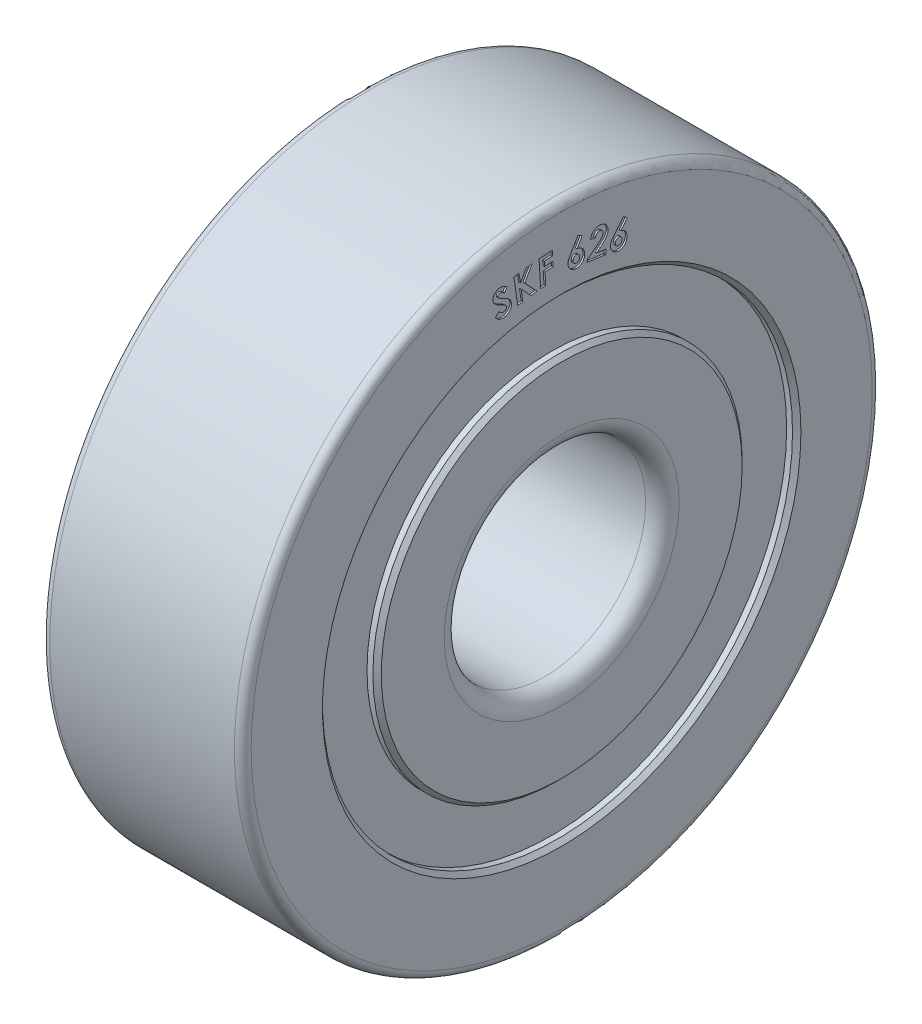
from build123d import *

# Parameters (mm, degrees)
CIRPATTERN2_COUNT = 8
WRAP1_START       = -0.05
WRAP1_DEPTH       = 0.05
SEAL_START        = 0.2
SKETCH7_R         = 7
SKETCH7_R_2       = 5.5
SEAL_1_DEPTH      = 0.2
SKETCH8_R         = 7
SKETCH8_R_2       = 5.5
SEAL_2_DEPTH      = 0.2


# Read off the part's stored shape, not the designer's step: Wrap1
with BuildPart() as part:
    # Sketch1 → Revolve1 (revolve)
    with BuildSketch(Plane.XY, mode=Mode.PRIVATE) as revolve1_sk:
        with BuildLine():
            Line((-5.875, 5.5), (-4.299038106, 5.5))
            ThreePointArc((-4.299038106, 5.5), (-3, 4.75), (-1.700961894, 5.5))
            Line((-1.700961894, 5.5), (-0.125, 5.5))
            Line((-0.125, 5.5), (0, 5.375))
            Line((0, 5.375), (0, 3.5))
            ThreePointArc((0, 3.5), (-0.146446609, 3.146446609), (-0.5, 3))
            Line((-0.5, 3), (-5.5, 3))
            ThreePointArc((-5.5, 3), (-5.853553391, 3.146446609), (-6, 3.5))
            Line((-6, 3.5), (-6, 5.375))
            Line((-6, 5.375), (-5.875, 5.5))
        make_face()
        with BuildLine():
            Line((-0.25, 9.5), (-5.75, 9.5))
            ThreePointArc((-5.75, 9.5), (-5.926776695, 9.426776695), (-6, 9.25))
            Line((-6, 9.25), (-6, 7.125))
            Line((-6, 7.125), (-5.875, 7))
            Line((-5.875, 7), (-4.299038106, 7))
            ThreePointArc((-4.299038106, 7), (-3, 7.75), (-1.700961894, 7))
            Line((-1.700961894, 7), (-0.125, 7))
            Line((-0.125, 7), (0, 7.125))
            Line((0, 7.125), (0, 9.25))
            ThreePointArc((0, 9.25), (-0.073223305, 9.426776695), (-0.25, 9.5))
        make_face()
    revolve(revolve1_sk.sketch.rotate(Axis((0, 0, 0), (-1, 0, 0)), 90), axis=Axis((0, 0, 0), (-1, 0, 0)))

    # Wrap1 outline → Wrap1 (cut)
    # profile 1 of 6: a face of its own
    with BuildSketch(Plane(origin=(0, 0, 0), x_dir=(0, 0, -1), z_dir=(1, 0, 0)).offset(WRAP1_START)):
        with BuildLine():
            add(Edge.make_bspline(
                [(1.759451654, 7.878047553), (1.767456237, 7.876009312), (1.783214619, 7.871996688), (1.805792313, 7.863431175), (1.826888574, 7.852751245), (1.846673566, 7.840301229), (1.864943624, 7.825682011), (1.881849984, 7.809129742), (1.897221692, 7.790428382), (1.911087649, 7.770056312), (1.922971706, 7.748399656), (1.932931888, 7.726066909), (1.940148731, 7.702980972), (1.944913784, 7.679291722), (1.947601462, 7.655037848), (1.947401916, 7.630193955), (1.945363646, 7.604777305), (1.941847034, 7.587902066), (1.940060628, 7.579329604)],
                knots=[0, 0, 0, 0, 0.063628939, 0.12526439, 0.185660671, 0.245628784, 0.305108674, 0.365668937, 0.427665021, 0.491388473, 0.555335004, 0.617834919, 0.679559695, 0.741332517, 0.803852771, 0.867260188, 0.932569432, 1, 1, 1, 1], degree=3))
            Line((1.759451654, 7.878047553), (1.95384268, 8.110579604))
            Line((1.95384268, 8.110579604), (1.842784987, 8.201284733))
            Line((1.842784987, 8.201284733), (1.556246526, 7.857053963))
            add(Edge.make_bspline(
                [(1.454323449, 7.687182169), (1.455772209, 7.693140455), (1.458678673, 7.70509381), (1.464904852, 7.72263858), (1.472435974, 7.739916901), (1.479880225, 7.754256548), (1.486899155, 7.766220449), (1.493448917, 7.77616438), (1.501106835, 7.787211921), (1.5097997, 7.799287093), (1.519867721, 7.812277564), (1.530852422, 7.8264292), (1.543229627, 7.841379188), (1.551811477, 7.851713337), (1.556246526, 7.857053963)],
                knots=[0, 0, 0, 0, 0.091831696, 0.18423027, 0.278509679, 0.3740984, 0.426127344, 0.486294002, 0.552460381, 0.627553072, 0.709202417, 0.798712819, 0.895975981, 1, 1, 1, 1], degree=3))
            add(Edge.make_bspline(
                [(1.644387552, 7.39247063), (1.635893671, 7.394592038), (1.619191541, 7.398763515), (1.595385072, 7.407955603), (1.572996737, 7.41872791), (1.552332504, 7.431841464), (1.533351688, 7.446980404), (1.515926624, 7.464131597), (1.499967987, 7.483215666), (1.486093956, 7.504308961), (1.473981868, 7.526320435), (1.464183077, 7.548874876), (1.456526953, 7.571526766), (1.451429447, 7.594417079), (1.448440481, 7.617435462), (1.448068335, 7.640626687), (1.449674181, 7.664010152), (1.452763594, 7.67940783), (1.454323449, 7.687182169)],
                knots=[0, 0, 0, 0, 0.067356912, 0.132448764, 0.196101472, 0.258410861, 0.32046855, 0.382716808, 0.446392107, 0.511650116, 0.576816012, 0.639633859, 0.700771309, 0.760647539, 0.819934485, 0.87918146, 0.938998315, 1, 1, 1, 1], degree=3))
            add(Edge.make_bspline(
                [(1.940060628, 7.579329604), (1.937974265, 7.571108735), (1.933865552, 7.554919227), (1.925071763, 7.531767052), (1.914572648, 7.509983377), (1.901722668, 7.489802033), (1.887017284, 7.471006069), (1.870131886, 7.453802424), (1.85154375, 7.43779732), (1.830960455, 7.423769274), (1.809350992, 7.411440272), (1.786972103, 7.401437604), (1.764151799, 7.393881122), (1.740958511, 7.388694595), (1.717325721, 7.386010321), (1.693282377, 7.385472296), (1.668782009, 7.387544607), (1.652588368, 7.390814622), (1.644387552, 7.39247063)],
                knots=[0, 0, 0, 0, 0.065304486, 0.128605324, 0.190456379, 0.251320337, 0.312582426, 0.373999182, 0.436769217, 0.501276298, 0.565603226, 0.628248985, 0.689814517, 0.750530771, 0.811030393, 0.872782763, 0.935574386, 1, 1, 1, 1], degree=3))
        make_face()
        with BuildLine():
            add(Edge.make_bspline(
                [(1.599195244, 7.658496271), (1.597870484, 7.651202037), (1.595298768, 7.637041953), (1.596676001, 7.615686092), (1.60156314, 7.595252116), (1.610839778, 7.576433856), (1.622711396, 7.559588059), (1.63749666, 7.546286332), (1.654082947, 7.535963406), (1.666490534, 7.532513275), (1.672752936, 7.530771912)],
                knots=[0, 0, 0, 0, 0.135523526, 0.263087855, 0.389278756, 0.518566272, 0.645572429, 0.764872283, 0.881325486, 1, 1, 1, 1], degree=3))
            add(Edge.make_bspline(
                [(1.719547808, 7.74070781), (1.712893119, 7.741844018), (1.699831173, 7.744074189), (1.680032218, 7.742553316), (1.661148825, 7.736693632), (1.643494686, 7.727122914), (1.627758208, 7.714113149), (1.614701054, 7.698173606), (1.604895781, 7.679372106), (1.601130936, 7.665584933), (1.599195244, 7.658496271)],
                knots=[0, 0, 0, 0, 0.124235, 0.243850773, 0.362356398, 0.486747757, 0.612088683, 0.736803861, 0.864677958, 1, 1, 1, 1], degree=3))
            add(Edge.make_bspline(
                [(1.796470885, 7.613944989), (1.797771987, 7.621183987), (1.800306139, 7.635283354), (1.799241223, 7.656505101), (1.794229616, 7.676630203), (1.785154301, 7.695191181), (1.772966463, 7.711680167), (1.757714863, 7.725156385), (1.739718989, 7.735219676), (1.726382087, 7.738848353), (1.719547808, 7.74070781)],
                knots=[0, 0, 0, 0, 0.132846275, 0.25874418, 0.381457329, 0.50607007, 0.630479865, 0.750427695, 0.872110733, 1, 1, 1, 1], degree=3))
            add(Edge.make_bspline(
                [(1.672752936, 7.530771912), (1.679463014, 7.529629068), (1.692635909, 7.527385494), (1.712653452, 7.529009179), (1.7320076, 7.534592617), (1.750273488, 7.544233496), (1.76675121, 7.557247216), (1.780325898, 7.573482657), (1.790697919, 7.592546522), (1.794511473, 7.6066821), (1.796470885, 7.613944989)],
                knots=[0, 0, 0, 0, 0.122596952, 0.240676296, 0.359208467, 0.484410996, 0.611489601, 0.736188821, 0.864453277, 1, 1, 1, 1], degree=3))
        make_face(mode=Mode.SUBTRACT)
    # profile 2 of 6: a face of its own
    with BuildSketch(Plane(origin=(0, 0, 0), x_dir=(0, 0, -1), z_dir=(1, 0, 0)).offset(WRAP1_START)):
        with BuildLine():
            add(Edge.make_bspline(
                [(0.854276442, 8.092509194), (0.856410428, 8.102752282), (0.860585519, 8.12279263), (0.869458753, 8.151523076), (0.880185403, 8.178300957), (0.892905757, 8.203049681), (0.907296927, 8.225956167), (0.923726648, 8.24675999), (0.942143101, 8.265463122), (0.96229424, 8.282098124), (0.983917072, 8.296474977), (1.006575197, 8.308617402), (1.030349662, 8.318105583), (1.055041161, 8.325183583), (1.080777845, 8.329664541), (1.107438306, 8.331674077), (1.135132326, 8.331474909), (1.15375598, 8.329230417), (1.163250801, 8.328086117)],
                knots=[0, 0, 0, 0, 0.07216084, 0.141180892, 0.207160892, 0.270955112, 0.332920472, 0.393534852, 0.45348102, 0.513698521, 0.57350061, 0.632365095, 0.69074757, 0.749780289, 0.809286327, 0.870657998, 0.934058103, 1, 1, 1, 1], degree=3))
            Line((0.854276442, 8.092509194), (1.000590545, 8.071836117))
            add(Edge.make_bspline(
                [(1.133923878, 8.18914381), (1.129976645, 8.18961132), (1.122205561, 8.190531727), (1.110593807, 8.190283273), (1.099325189, 8.189013692), (1.088377823, 8.186668189), (1.077810382, 8.182870695), (1.06759863, 8.17793185), (1.057765956, 8.171741647), (1.048294822, 8.164591091), (1.039514897, 8.156187081), (1.031339495, 8.146967996), (1.024076566, 8.136739076), (1.017622004, 8.125591302), (1.012034399, 8.113466144), (1.007496321, 8.100372931), (1.003299139, 8.086525914), (1.001510733, 8.076826669), (1.000590545, 8.071836117)],
                knots=[0, 0, 0, 0, 0.060096578, 0.118314671, 0.175278541, 0.231578709, 0.287324642, 0.344819642, 0.402925345, 0.4629185, 0.524114496, 0.586558224, 0.649153559, 0.713636717, 0.781286069, 0.850845839, 0.923255724, 1, 1, 1, 1], degree=3))
            add(Edge.make_bspline(
                [(1.227513621, 8.068951502), (1.228184875, 8.076322381), (1.229484059, 8.090588421), (1.226465974, 8.111687643), (1.219319663, 8.131239885), (1.208132616, 8.148841534), (1.193849295, 8.164234881), (1.176467201, 8.176419564), (1.156158579, 8.184946902), (1.141529107, 8.187708286), (1.133923878, 8.18914381)],
                knots=[0, 0, 0, 0, 0.129857538, 0.25133405, 0.371450626, 0.493482068, 0.615820717, 0.738620533, 0.864120117, 1, 1, 1, 1], degree=3))
            add(Edge.make_bspline(
                [(1.046584134, 7.847316886), (1.054666299, 7.853599802), (1.070276882, 7.865735163), (1.092601144, 7.883621981), (1.11281371, 7.900821537), (1.131115744, 7.917088392), (1.147336531, 7.932674324), (1.161592771, 7.947340901), (1.173879157, 7.961161146), (1.187288383, 7.978091292), (1.20082031, 7.998538191), (1.213673897, 8.022585772), (1.223112528, 8.045798263), (1.226089985, 8.061462048), (1.227513621, 8.068951502)],
                knots=[0, 0, 0, 0, 0.104888376, 0.202590368, 0.293064942, 0.376789794, 0.453435045, 0.523494973, 0.586311268, 0.642813284, 0.744671903, 0.836977179, 0.922052562, 1, 1, 1, 1], degree=3))
            Line((1.046584134, 7.847316886), (0.76773798, 7.63289381))
            Line((0.76773798, 7.63289381), (0.757641827, 7.561098938))
            Line((0.757641827, 7.561098938), (1.303635416, 7.484336117))
            Line((1.303635416, 7.484336117), (1.323186698, 7.623118168))
            Line((1.323186698, 7.623118168), (1.042417468, 7.662701502))
            Line((1.042417468, 7.662701502), (1.144020032, 7.743470733))
            add(Edge.make_bspline(
                [(1.377994391, 8.059816886), (1.376993285, 8.053927932), (1.374969287, 8.04202186), (1.370625647, 8.02410998), (1.364789861, 8.006126897), (1.357933924, 7.987873146), (1.349511428, 7.969628121), (1.33988991, 7.951173022), (1.328941648, 7.932585672), (1.316729101, 7.913664715), (1.302627903, 7.894481912), (1.286517091, 7.874657135), (1.268109168, 7.854341375), (1.247682159, 7.833179786), (1.22487594, 7.811679626), (1.200011016, 7.789355341), (1.172913502, 7.766430993), (1.15383727, 7.751272023), (1.144020032, 7.743470733)],
                knots=[0, 0, 0, 0, 0.044450552, 0.089868489, 0.13701961, 0.185088725, 0.234905083, 0.286475386, 0.339934452, 0.395403326, 0.454010667, 0.517035217, 0.58544749, 0.657987739, 0.735885604, 0.818660122, 0.906676704, 1, 1, 1, 1], degree=3))
            add(Edge.make_bspline(
                [(1.163250801, 8.328086117), (1.174853771, 8.326126723), (1.197529512, 8.322297468), (1.229780593, 8.311880346), (1.259423195, 8.298100652), (1.286119125, 8.280639181), (1.310055872, 8.2602272), (1.330783873, 8.236621133), (1.348017848, 8.209803967), (1.361846049, 8.18067026), (1.37226801, 8.150348079), (1.378583956, 8.119829449), (1.380968155, 8.089545264), (1.378982103, 8.069690937), (1.377994391, 8.059816886)],
                knots=[0, 0, 0, 0, 0.092156886, 0.180102664, 0.264785891, 0.347726877, 0.429403109, 0.510720994, 0.593082626, 0.678503117, 0.763000764, 0.843823192, 0.922329385, 1, 1, 1, 1], degree=3))
        make_face()
    # profile 3 of 6: a face of its own
    with BuildSketch(Plane(origin=(0, 0, 0), x_dir=(0, 0, -1), z_dir=(1, 0, 0)).offset(WRAP1_START)):
        with BuildLine():
            add(Edge.make_bspline(
                [(0.456488424, 8.062377274), (0.464734142, 8.061674883), (0.48101178, 8.060288311), (0.504806963, 8.055593582), (0.527537307, 8.048709657), (0.549168876, 8.039482048), (0.569760664, 8.028077752), (0.589250494, 8.014365298), (0.607538763, 7.998398634), (0.624589511, 7.980530609), (0.640036061, 7.96114985), (0.653477499, 7.940523537), (0.664490113, 7.918838269), (0.673477671, 7.89624373), (0.679797341, 7.872613398), (0.683986169, 7.848047806), (0.685970023, 7.822501537), (0.685442568, 7.805167279), (0.685174321, 7.796351633)],
                knots=[0, 0, 0, 0, 0.063447643, 0.125250183, 0.185658011, 0.245331646, 0.305314037, 0.365910605, 0.427783752, 0.491259179, 0.555130211, 0.617645975, 0.679775074, 0.741414368, 0.803844114, 0.867037159, 0.932379372, 1, 1, 1, 1], degree=3))
            Line((0.456488424, 8.062377274), (0.610494834, 8.325197787))
            Line((0.610494834, 8.325197787), (0.485494834, 8.396832402))
            Line((0.485494834, 8.396832402), (0.258571757, 8.007890095))
            add(Edge.make_bspline(
                [(0.185815347, 7.822633685), (0.186318404, 7.828786169), (0.187329021, 7.841146213), (0.190392298, 7.859588011), (0.194943563, 7.877943942), (0.19987281, 7.893371372), (0.205059749, 7.906271933), (0.209617355, 7.917367501), (0.215474015, 7.929492417), (0.222234792, 7.942833802), (0.229943893, 7.957410919), (0.238568564, 7.973240776), (0.248189822, 7.990227527), (0.255029367, 8.001863502), (0.258571757, 8.007890095)],
                knots=[0, 0, 0, 0, 0.092039995, 0.184903876, 0.278428428, 0.373917537, 0.426143169, 0.485774236, 0.552773827, 0.626885118, 0.708853518, 0.798698404, 0.895740337, 1, 1, 1, 1], degree=3))
            add(Edge.make_bspline(
                [(0.422994834, 7.561896505), (0.414214561, 7.562648615), (0.396974613, 7.564125373), (0.371781508, 7.568984025), (0.347830671, 7.576112176), (0.3252679, 7.585918889), (0.303827414, 7.597590583), (0.283645304, 7.611631807), (0.264860133, 7.628092014), (0.247560071, 7.646574995), (0.23203403, 7.666418897), (0.218452205, 7.687015122), (0.207107845, 7.708214321), (0.198366427, 7.730146305), (0.191491604, 7.752460676), (0.18716143, 7.77540633), (0.185229507, 7.798883821), (0.185618964, 7.814672341), (0.185815347, 7.822633685)],
                knots=[0, 0, 0, 0, 0.06747911, 0.132494315, 0.19619521, 0.258532608, 0.320625011, 0.382954347, 0.446480144, 0.511625321, 0.576631509, 0.639290512, 0.700439698, 0.760479037, 0.819907087, 0.879063942, 0.939018132, 1, 1, 1, 1], degree=3))
            add(Edge.make_bspline(
                [(0.685174321, 7.796351633), (0.684492469, 7.787836088), (0.683153731, 7.771116821), (0.678204139, 7.746699457), (0.671177395, 7.723465204), (0.6620041, 7.701227055), (0.650369862, 7.680251266), (0.636700903, 7.660232712), (0.62072137, 7.641414951), (0.602747249, 7.623985071), (0.583318421, 7.608159366), (0.56281917, 7.594516513), (0.541496041, 7.5832182), (0.519421051, 7.574112234), (0.49638854, 7.567584742), (0.472615553, 7.563293311), (0.448032446, 7.561049113), (0.431437913, 7.561610751), (0.422994834, 7.561896505)],
                knots=[0, 0, 0, 0, 0.065428564, 0.128461246, 0.190502112, 0.251255623, 0.312458612, 0.374011194, 0.436762672, 0.501329821, 0.565657668, 0.628567894, 0.689742116, 0.750339529, 0.811247363, 0.872843505, 0.935304462, 1, 1, 1, 1], degree=3))
        make_face()
        with BuildLine():
            add(Edge.make_bspline(
                [(0.334212783, 7.818146505), (0.334141345, 7.810753395), (0.334001603, 7.796291379), (0.338630879, 7.775285542), (0.347179283, 7.75592824), (0.359268378, 7.738678076), (0.374012683, 7.724160459), (0.390635214, 7.713153664), (0.408833641, 7.705892124), (0.421649601, 7.704451233), (0.428123039, 7.703723428)],
                knots=[0, 0, 0, 0, 0.134746447, 0.263583941, 0.389440509, 0.519132851, 0.646127188, 0.765236844, 0.881419367, 1, 1, 1, 1], degree=3))
            add(Edge.make_bspline(
                [(0.439821757, 7.919588813), (0.433012049, 7.919608225), (0.419691978, 7.919646197), (0.400290749, 7.91480505), (0.382495985, 7.905905528), (0.36656218, 7.893401348), (0.353094919, 7.877932338), (0.342988654, 7.859939402), (0.336398422, 7.839771915), (0.334957428, 7.825514261), (0.334212783, 7.818146505)],
                knots=[0, 0, 0, 0, 0.124690271, 0.243899329, 0.363237497, 0.487657315, 0.613542145, 0.737419285, 0.864309321, 1, 1, 1, 1], degree=3))
            add(Edge.make_bspline(
                [(0.536937142, 7.8067683), (0.536996148, 7.814159052), (0.537111065, 7.828552902), (0.532715045, 7.849412972), (0.524327776, 7.868483707), (0.512295025, 7.885338662), (0.497479836, 7.899675562), (0.480188073, 7.91045737), (0.460717843, 7.917475454), (0.44693121, 7.918869787), (0.439821757, 7.919588813)],
                knots=[0, 0, 0, 0, 0.133049271, 0.259119961, 0.381238965, 0.506377976, 0.630432414, 0.750770185, 0.871477849, 1, 1, 1, 1], degree=3))
            add(Edge.make_bspline(
                [(0.428123039, 7.703723428), (0.434991661, 7.703683225), (0.448440732, 7.703604506), (0.468023272, 7.708773365), (0.486266397, 7.717563899), (0.502830411, 7.730106387), (0.51714134, 7.745597285), (0.527658078, 7.764045264), (0.53486977, 7.784584274), (0.53623451, 7.799228682), (0.536937142, 7.8067683)],
                knots=[0, 0, 0, 0, 0.122998707, 0.240836987, 0.360225965, 0.485051329, 0.6121639, 0.736504533, 0.864340367, 1, 1, 1, 1], degree=3))
        make_face(mode=Mode.SUBTRACT)
    # profile 4 of 6: a face of its own
    with BuildSketch(Plane(origin=(0, 0, 0), x_dir=(0, 0, -1), z_dir=(1, 0, 0)).offset(WRAP1_START)):
        with BuildLine():
            add(Edge.make_bspline(
                [(-1.709010615, 8.002365382), (-1.715129781, 8.007590236), (-1.726932219, 8.017667754), (-1.745171218, 8.030625686), (-1.762900161, 8.04115707), (-1.780036912, 8.0493871), (-1.796842928, 8.054678447), (-1.813089585, 8.057731413), (-1.828925396, 8.058174766), (-1.83910127, 8.056429168), (-1.844106769, 8.055570511)],
                knots=[0, 0, 0, 0, 0.160195847, 0.308980266, 0.444915779, 0.570570229, 0.686653874, 0.794755029, 0.899040267, 1, 1, 1, 1], degree=3))
            Line((-1.709010615, 8.002365382), (-1.622311897, 8.123358972))
            add(Edge.make_bspline(
                [(-1.874234974, 8.196916665), (-1.864600577, 8.198839165), (-1.845460783, 8.202658425), (-1.816190401, 8.203652305), (-1.786917047, 8.201711753), (-1.76257071, 8.196746997), (-1.742741046, 8.191086399), (-1.727252644, 8.185246158), (-1.711172053, 8.178141061), (-1.694501419, 8.169770666), (-1.677221156, 8.160165452), (-1.659362438, 8.14920703), (-1.640962385, 8.136849284), (-1.628641867, 8.12793758), (-1.622311897, 8.123358972)],
                knots=[0, 0, 0, 0, 0.10827595, 0.215102132, 0.322099035, 0.431489829, 0.488589086, 0.549594541, 0.614012172, 0.682571047, 0.755417687, 0.832170822, 0.913773626, 1, 1, 1, 1], degree=3))
            add(Edge.make_bspline(
                [(-2.041863179, 7.952846152), (-2.04316336, 7.959503855), (-2.045727711, 7.972634859), (-2.047368589, 7.992456605), (-2.046711045, 8.011968431), (-2.043912155, 8.031178432), (-2.039286483, 8.050155276), (-2.032530184, 8.068886486), (-2.023413965, 8.087144835), (-2.012588236, 8.105037951), (-2.00005245, 8.122000469), (-1.986120958, 8.137702744), (-1.970553374, 8.151494543), (-1.953894675, 8.163859905), (-1.935954515, 8.174723166), (-1.916609602, 8.183844466), (-1.895952033, 8.191411713), (-1.881536991, 8.195065712), (-1.874234974, 8.196916665)],
                knots=[0, 0, 0, 0, 0.061706444, 0.121703774, 0.180563573, 0.239006258, 0.298082513, 0.358062111, 0.419812591, 0.483515034, 0.548178674, 0.611527635, 0.674190059, 0.737102829, 0.800137586, 0.864726248, 0.931476346, 1, 1, 1, 1], degree=3))
            add(Edge.make_bspline(
                [(-1.780164461, 7.727685895), (-1.792156403, 7.733671184), (-1.815181279, 7.745163111), (-1.84791089, 7.762518937), (-1.877594362, 7.778979461), (-1.904144367, 7.794649176), (-1.927642831, 7.809320442), (-1.947895803, 7.823292338), (-1.965136959, 7.836308217), (-1.983459467, 7.852520138), (-2.002219385, 7.872839001), (-2.020200564, 7.89837137), (-2.034086158, 7.924859241), (-2.039292263, 7.943594283), (-2.041863179, 7.952846152)],
                knots=[0, 0, 0, 0, 0.112719796, 0.216425271, 0.311556546, 0.39816443, 0.475696597, 0.544489667, 0.605056225, 0.657254276, 0.750098278, 0.836851707, 0.919432973, 1, 1, 1, 1], degree=3))
            add(Edge.make_bspline(
                [(-1.644587538, 7.618711536), (-1.645824373, 7.623042433), (-1.648343864, 7.631864673), (-1.655141118, 7.644354731), (-1.664492246, 7.656103974), (-1.67413819, 7.665447711), (-1.68356716, 7.672953611), (-1.692488637, 7.679203036), (-1.703014208, 7.686050988), (-1.715218675, 7.693393394), (-1.729036334, 7.701288951), (-1.744613179, 7.709522764), (-1.761741968, 7.718586113), (-1.773845457, 7.724564626), (-1.780164461, 7.727685895)],
                knots=[0, 0, 0, 0, 0.075187645, 0.153160762, 0.235944607, 0.325701743, 0.377211205, 0.437476499, 0.507884735, 0.587289417, 0.675760048, 0.774133617, 0.882079426, 1, 1, 1, 1], degree=3))
            add(Edge.make_bspline(
                [(-1.717183692, 7.525121793), (-1.711131387, 7.526794238), (-1.699427753, 7.530028327), (-1.68335062, 7.53804319), (-1.669571263, 7.54857817), (-1.658244698, 7.561241278), (-1.649572457, 7.575101502), (-1.644310802, 7.589627569), (-1.642262849, 7.60436399), (-1.643810133, 7.613913538), (-1.644587538, 7.618711536)],
                knots=[0, 0, 0, 0, 0.143416428, 0.277331291, 0.408114034, 0.537933778, 0.664124174, 0.779718861, 0.889323701, 1, 1, 1, 1], degree=3))
            add(Edge.make_bspline(
                [(-1.868786256, 7.598198716), (-1.86234237, 7.591127276), (-1.85005872, 7.577647353), (-1.830410753, 7.560254852), (-1.811319993, 7.54572552), (-1.792033216, 7.534905428), (-1.773075348, 7.527064836), (-1.754141002, 7.523136871), (-1.735398942, 7.521775093), (-1.723254755, 7.524006352), (-1.717183692, 7.525121793)],
                knots=[0, 0, 0, 0, 0.162243303, 0.309276108, 0.444717657, 0.568521608, 0.683668616, 0.791243736, 0.895639584, 1, 1, 1, 1], degree=3))
            Line((-1.868786256, 7.598198716), (-1.975356769, 7.4953141))
            add(Edge.make_bspline(
                [(-1.688177281, 7.384576921), (-1.694997791, 7.383141129), (-1.708408771, 7.380317972), (-1.7285595, 7.377860728), (-1.748305313, 7.376414904), (-1.76769707, 7.376854413), (-1.786719015, 7.378380264), (-1.805364592, 7.381456798), (-1.823646964, 7.385922072), (-1.841531256, 7.391912103), (-1.859124527, 7.399318507), (-1.876462376, 7.408358225), (-1.893632578, 7.418920946), (-1.910438777, 7.431225817), (-1.92717733, 7.444811913), (-1.943515303, 7.460162618), (-1.959758367, 7.476982582), (-1.970079901, 7.489112632), (-1.975356769, 7.4953141)],
                knots=[0, 0, 0, 0, 0.06398805, 0.125817931, 0.18629368, 0.245668755, 0.303771338, 0.361443517, 0.419038426, 0.476444944, 0.534491568, 0.594180024, 0.655861781, 0.719457379, 0.785358042, 0.853746799, 0.925228284, 1, 1, 1, 1], degree=3))
            add(Edge.make_bspline(
                [(-1.501318307, 7.658134613), (-1.499704352, 7.650307748), (-1.496540763, 7.634965942), (-1.49478933, 7.611854658), (-1.49478528, 7.589367584), (-1.497365223, 7.567424498), (-1.502415678, 7.546116787), (-1.509671629, 7.525335022), (-1.519172016, 7.505090933), (-1.530834346, 7.485570476), (-1.544585042, 7.467254656), (-1.559981192, 7.450333453), (-1.577134214, 7.435152288), (-1.595992261, 7.42164071), (-1.616619397, 7.409760794), (-1.638931925, 7.399519247), (-1.662919162, 7.390976106), (-1.67964452, 7.38673871), (-1.688177281, 7.384576921)],
                knots=[0, 0, 0, 0, 0.064457205, 0.126345589, 0.18672494, 0.245782177, 0.304258647, 0.363180305, 0.423182668, 0.484497384, 0.546427827, 0.607784996, 0.66888548, 0.731001847, 0.794765679, 0.860761275, 0.928964699, 1, 1, 1, 1], degree=3))
            add(Edge.make_bspline(
                [(-1.623754204, 7.815987177), (-1.615055862, 7.810248196), (-1.598359643, 7.799232386), (-1.575899679, 7.781207039), (-1.556595747, 7.763127815), (-1.540570061, 7.744421514), (-1.52740719, 7.724760631), (-1.516211457, 7.704088346), (-1.507518518, 7.681696634), (-1.503410681, 7.666086047), (-1.501318307, 7.658134613)],
                knots=[0, 0, 0, 0, 0.152029297, 0.291815878, 0.419763936, 0.537567645, 0.650448819, 0.764511271, 0.880051091, 1, 1, 1, 1], degree=3))
            add(Edge.make_bspline(
                [(-1.746190102, 7.881532049), (-1.738220828, 7.877491402), (-1.723048475, 7.869798588), (-1.701677467, 7.858589783), (-1.682748451, 7.848588749), (-1.666135749, 7.840026901), (-1.652128745, 7.832262768), (-1.640404651, 7.825941736), (-1.631207916, 7.820657988), (-1.625990295, 7.817388406), (-1.623754204, 7.815987177)],
                knots=[0, 0, 0, 0, 0.19297103, 0.367389173, 0.521173054, 0.655344525, 0.770990723, 0.867025122, 0.943011601, 1, 1, 1, 1], degree=3))
            add(Edge.make_bspline(
                [(-1.876799076, 7.956211536), (-1.874471195, 7.954416845), (-1.8690559, 7.950241898), (-1.859136178, 7.943966212), (-1.846789113, 7.936304021), (-1.83170532, 7.927658946), (-1.814127411, 7.917684674), (-1.793736228, 7.906739097), (-1.770915735, 7.894325253), (-1.7547, 7.885935126), (-1.746190102, 7.881532049)],
                knots=[0, 0, 0, 0, 0.058532544, 0.136162857, 0.233631275, 0.348079095, 0.482458698, 0.636275553, 0.809120083, 1, 1, 1, 1], degree=3))
            add(Edge.make_bspline(
                [(-1.898273435, 7.990025639), (-1.897373688, 7.986829621), (-1.895571388, 7.98042762), (-1.890769169, 7.971590583), (-1.884565824, 7.96335485), (-1.879445475, 7.958645509), (-1.876799076, 7.956211536)],
                knots=[0, 0, 0, 0, 0.243895421, 0.488551433, 0.735663197, 1, 1, 1, 1], degree=3))
            add(Edge.make_bspline(
                [(-1.844106769, 8.055570511), (-1.848704123, 8.054339123), (-1.857511261, 8.051980156), (-1.869441854, 8.046012142), (-1.879799263, 8.038640828), (-1.887946266, 8.029510087), (-1.894243924, 8.019846162), (-1.898311084, 8.009908932), (-1.899698986, 7.999793664), (-1.89874803, 7.993277615), (-1.898273435, 7.990025639)],
                knots=[0, 0, 0, 0, 0.151629987, 0.290477149, 0.423545373, 0.555162379, 0.678669664, 0.790491532, 0.895440219, 1, 1, 1, 1], degree=3))
        make_face()
    # profile 5 of 6: a face of its own
    with BuildSketch(Plane(origin=(0, 0, 0), x_dir=(0, 0, -1), z_dir=(1, 0, 0)).offset(WRAP1_START)):
        Polygon((-0.271323542, 8.243584017), (-0.280458157, 8.391340427), (-0.675169696, 8.367301966), (-0.626451747, 7.571628889), (-0.47677226, 7.580763504), (-0.498727388, 7.938776325), (-0.253695337, 7.953680171), (-0.262509439, 8.099192992), (-0.507541491, 8.084289145), (-0.516355593, 8.228680171), align=None)
    # profile 6 of 6: a face of its own
    with BuildSketch(Plane(origin=(0, 0, 0), x_dir=(0, 0, -1), z_dir=(1, 0, 0)).offset(WRAP1_START)):
        Polygon((-1.232314482, 8.021412806), (-1.270936276, 8.292566652), (-1.422699097, 8.270932037), (-1.31051961, 7.482630755), (-1.158756789, 7.50426537), (-1.208596533, 7.854105114), (-0.915487558, 7.538880755), (-0.737602943, 7.564201268), (-1.10202602, 7.957791011), (-0.876545251, 8.348656396), (-1.057154225, 8.32301537), align=None)
    extrude(amount=WRAP1_DEPTH, mode=Mode.SUBTRACT)

    # Sketch7 → Seal 1 (add)
    with BuildSketch(Plane(origin=(-0.5, 0, 0), x_dir=(0, 0, -1), z_dir=(1, 0, 0)).offset(SEAL_START)):
        Circle(SKETCH7_R)
        Circle(SKETCH7_R_2, mode=Mode.SUBTRACT)
    extrude(amount=-SEAL_1_DEPTH)

    # Sketch8 → Seal 2 (add)
    with BuildSketch(Plane.ZY.offset(5.5)):
        with Locations(Location((0, 0, 0), (0, 0, 180))):
            Circle(SKETCH8_R)
        with Locations(Location((0, 0, 0), (0, 0, 180))):
            Circle(SKETCH8_R_2, mode=Mode.SUBTRACT)
    extrude(amount=SEAL_2_DEPTH)


with BuildPart() as body_2:
    # Sketch2 → Revolve2 (revolve)
    with BuildSketch(Plane.XY):
        with BuildLine():
            Line((-3, 7.75), (-3, 4.75))
            ThreePointArc((-3, 4.75), (-1.5, 6.25), (-3, 7.75))
        make_face()
    revolve(axis=Axis((-3, 7.75, 0), (0, -1, 0)))


with BuildPart() as cirpattern2_1:
    # CirPattern2: pattern copy
    add(body_2.part.rotate(Axis((0, 0, 0), (1, 0, 0)), 1 * 360 / CIRPATTERN2_COUNT))


with BuildPart() as cirpattern2_2:
    # CirPattern2: pattern copy
    add(body_2.part.rotate(Axis((0, 0, 0), (1, 0, 0)), 2 * 360 / CIRPATTERN2_COUNT))


with BuildPart() as cirpattern2_3:
    # CirPattern2: pattern copy
    add(body_2.part.rotate(Axis((0, 0, 0), (1, 0, 0)), 3 * 360 / CIRPATTERN2_COUNT))


with BuildPart() as cirpattern2_4:
    # CirPattern2: pattern copy
    add(body_2.part.rotate(Axis((0, 0, 0), (1, 0, 0)), 4 * 360 / CIRPATTERN2_COUNT))


with BuildPart() as cirpattern2_5:
    # CirPattern2: pattern copy
    add(body_2.part.rotate(Axis((0, 0, 0), (1, 0, 0)), 5 * 360 / CIRPATTERN2_COUNT))


with BuildPart() as cirpattern2_6:
    # CirPattern2: pattern copy
    add(body_2.part.rotate(Axis((0, 0, 0), (1, 0, 0)), 6 * 360 / CIRPATTERN2_COUNT))


with BuildPart() as cirpattern2_7:
    # CirPattern2: pattern copy
    add(body_2.part.rotate(Axis((0, 0, 0), (1, 0, 0)), 7 * 360 / CIRPATTERN2_COUNT))


solid = Compound([part.part, body_2.part, cirpattern2_1.part, cirpattern2_2.part, cirpattern2_3.part, cirpattern2_4.part, cirpattern2_5.part, cirpattern2_6.part, cirpattern2_7.part])
